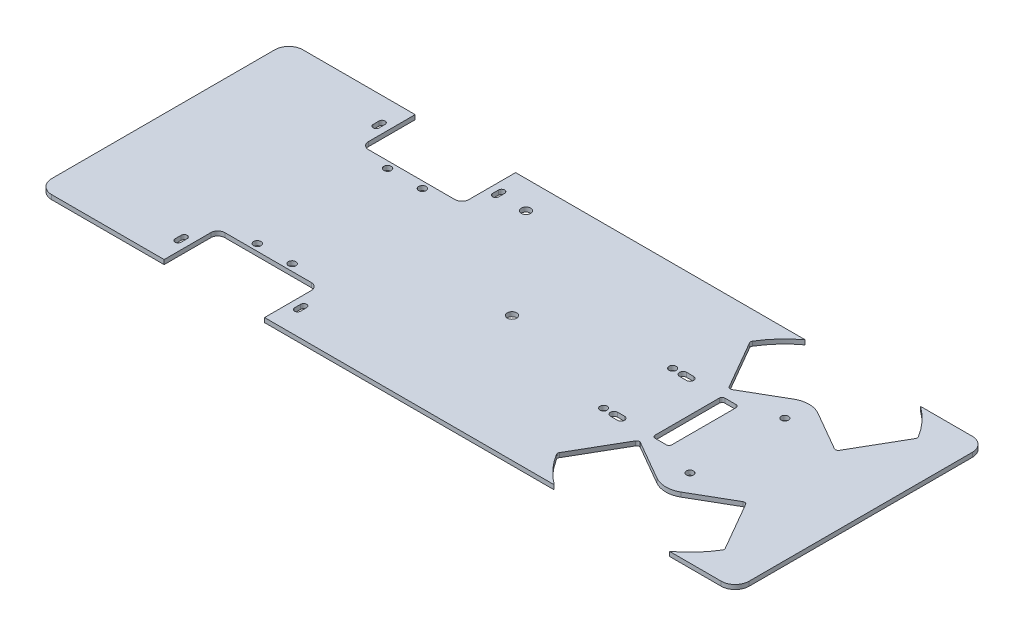
from build123d import *

# Parameters (mm, degrees)
SKETCH1_W           = 500
SKETCH1_H           = 180
BASE_FLANGE1_DEPTH  = 3.175
FILLET1_R           = 10
SKETCH13_R          = 2.65
CUT_EXTRUDE4_DEPTH  = 266.725573901
CUT_EXTRUDE5_DEPTH  = 266.725573901
CUT_EXTRUDE6_DEPTH  = 266.725573901
SKETCH21_R          = 2.55
CUT_EXTRUDE7_DEPTH  = 10
CUT_EXTRUDE8_DEPTH  = 266.725573901
SKETCH26_R          = 3.35
CUT_EXTRUDE9_DEPTH  = 266.725573901
SKETCH27_R          = 3.35
CUT_EXTRUDE10_DEPTH = 266.725573901


# Sheet-metal steps are written as plain solids
with BuildPart() as part:
    # Sketch1 → Base-Flange1 (new body)
    with BuildSketch(Plane(origin=(0, 0, 0), x_dir=(1, 0, 0), z_dir=(0, 1, 0))):
        Rectangle(SKETCH1_W, SKETCH1_H)
    extrude(amount=-BASE_FLANGE1_DEPTH)

    # Fillet1
    fillet1_edges = [part.edges().sort_by_distance(p)[0] for p in [
        (250, -1.5875, 90),
        (-250, -1.5875, 90),
        (-250, -1.5875, -90),
        (250, -1.5875, -90),
    ]]
    fillet(fillet1_edges, radius=FILLET1_R)

    # Sketch13 → Cut-Extrude4 (cut, through all)
    with BuildSketch(Plane(origin=(0, 0, 0), x_dir=(1, 0, 0), z_dir=(0, 1, 0))):
        with Locations(Location((-135.913126074, 46.6872, 0), (0, 0, 270))):
            Circle(SKETCH13_R)
        with Locations(Location((-135.913126074, -46.6872, 0), (0, 0, 270))):
            Circle(SKETCH13_R)
        with Locations(Location((-110.913126074, -46.6872, 0), (0, 0, 270))):
            Circle(SKETCH13_R)
        with Locations(Location((-110.913126074, 46.6872, 0), (0, 0, 270))):
            Circle(SKETCH13_R)
    extrude(amount=-CUT_EXTRUDE4_DEPTH, mode=Mode.SUBTRACT)

    # Sketch15 → Cut-Extrude5 (cut, through all)
    with BuildSketch(Plane(origin=(0, 0, 0), x_dir=(1, 0, 0), z_dir=(0, 1, 0))):
        with BuildLine():
            Line((-159.413126074, -90), (-87.413126074, -90))
            Line((-87.413126074, -90), (-87.413126074, -56.5))
            ThreePointArc((-87.413126074, -56.5), (-88.877592168, -52.964466094), (-92.413126074, -51.5))
            Line((-92.413126074, -51.5), (-154.413126074, -51.5))
            ThreePointArc((-154.413126074, -51.5), (-157.94865998, -52.964466094), (-159.413126074, -56.5))
            Line((-159.413126074, -56.5), (-159.413126074, -90))
        make_face()
    cut_extrude5 = extrude(amount=-CUT_EXTRUDE5_DEPTH, mode=Mode.SUBTRACT)

    # Mirror1: Cut-Extrude5 across plane
    add(cut_extrude5.mirror(Plane.XY), mode=Mode.SUBTRACT)

    # Sketch16 → Cut-Extrude6 (cut, through all)
    with BuildSketch(Plane(origin=(0, 0, 0), x_dir=(1, 0, 0), z_dir=(0, 1, 0))):
        with BuildLine():
            Line((-82.726681877, 68.835), (-82.726681877, 73.135))
            ThreePointArc((-82.726681877, 73.135), (-80.576681877, 75.285), (-78.426681877, 73.135))
            Line((-78.426681877, 73.135), (-78.426681877, 68.835))
            ThreePointArc((-78.426681877, 68.835), (-80.576681877, 66.685), (-82.726681877, 68.835))
        make_face()
        with BuildLine():
            Line((-164.09957027, 68.835), (-164.09957027, 73.135))
            ThreePointArc((-164.09957027, 73.135), (-166.24957027, 75.285), (-168.39957027, 73.135))
            Line((-168.39957027, 73.135), (-168.39957027, 68.835))
            ThreePointArc((-168.39957027, 68.835), (-166.24957027, 66.685), (-164.09957027, 68.835))
        make_face()
    cut_extrude6 = extrude(amount=-CUT_EXTRUDE6_DEPTH, mode=Mode.SUBTRACT)

    # Sketch21 → Cut-Extrude7 (cut)
    with BuildSketch(Plane(origin=(0, 0, 0), x_dir=(1, 0, 0), z_dir=(0, 1, 0))):
        with Locations(Location((90.388844999, -24.75, 0), (0, 0, 270))):
            Circle(SKETCH21_R)
        with Locations(Location((161.611770889, -34, 0), (0, 0, 270))):
            Circle(SKETCH21_R)
        with BuildLine():
            Line((102.888844999, -27.3), (97.888844999, -27.3))
            ThreePointArc((97.888844999, -27.3), (95.338844999, -24.75), (97.888844999, -22.2))
            Line((97.888844999, -22.2), (102.888844999, -22.2))
            ThreePointArc((102.888844999, -22.2), (105.438844999, -24.75), (102.888844999, -27.3))
        make_face()
        with BuildLine():
            Line((122.145496999, -33.557591563), (102.145496999, -68.198607715))
            ThreePointArc((102.145496999, -68.198607715), (101.877690583, -69.222505113), (102.169887266, -70.239710725))
            ThreePointArc((102.169887266, -70.239710725), (161.611770889, -103.617915525), (221.053654512, -70.239710725))
            ThreePointArc((221.053654512, -70.239710725), (221.345851195, -69.222505113), (221.07804478, -68.198607715))
            Line((221.07804478, -68.198607715), (201.07804478, -33.557591563))
            ThreePointArc((201.07804478, -33.557591563), (199.863632062, -32.625739911), (198.345993972, -32.825540756))
            Line((198.345993972, -32.825540756), (170.286770889, -49.025540756))
            ThreePointArc((170.286770889, -49.025540756), (161.611770889, -51.35), (152.936770889, -49.025540756))
            Line((152.936770889, -49.025540756), (124.877547807, -32.825540756))
            ThreePointArc((124.877547807, -32.825540756), (123.359909716, -32.625739911), (122.145496999, -33.557591563))
        make_face()
    cut_extrude7 = extrude(amount=-CUT_EXTRUDE7_DEPTH, mode=Mode.SUBTRACT)

    # Mirror2: Cut-Extrude7 across plane
    add(cut_extrude7.mirror(Plane.XY), mode=Mode.SUBTRACT)

    # Mirror3: Cut-Extrude6 across plane
    add(cut_extrude6.mirror(Plane.XY), mode=Mode.SUBTRACT)

    # Sketch25 → Cut-Extrude8 (cut, through all)
    with BuildSketch(Plane(origin=(0, 0, 0), x_dir=(1, 0, 0), z_dir=(0, 1, 0))):
        with BuildLine():
            Line((127.608844999, 25), (135.608844999, 25))
            ThreePointArc((135.608844999, 25), (137.023058561, 24.414213562), (137.608844999, 23))
            Line((137.608844999, 23), (137.608844999, -23))
            ThreePointArc((137.608844999, -23), (137.023058561, -24.414213562), (135.608844999, -25))
            Line((135.608844999, -25), (127.608844999, -25))
            ThreePointArc((127.608844999, -25), (126.194631437, -24.414213562), (125.608844999, -23))
            Line((125.608844999, -23), (125.608844999, 23))
            ThreePointArc((125.608844999, 23), (126.194631437, 24.414213562), (127.608844999, 25))
        make_face()
    extrude(amount=-CUT_EXTRUDE8_DEPTH, mode=Mode.SUBTRACT)

    # Sketch26 → Cut-Extrude9 (cut, through all)
    with BuildSketch(Plane(origin=(0, 0, 0), x_dir=(1, 0, 0), z_dir=(0, 1, 0))):
        with Locations(Location((0, 0, 0), (0, 0, 270))):
            Circle(SKETCH26_R)
    extrude(amount=-CUT_EXTRUDE9_DEPTH, mode=Mode.SUBTRACT)

    # Sketch27 → Cut-Extrude10 (cut, through all)
    with BuildSketch(Plane(origin=(0, 0, 0), x_dir=(1, 0, 0), z_dir=(0, 1, 0))):
        with Locations(Location((-60, 70, 0), (0, 0, 270))):
            Circle(SKETCH27_R)
    extrude(amount=-CUT_EXTRUDE10_DEPTH, mode=Mode.SUBTRACT)


solid = part.part
